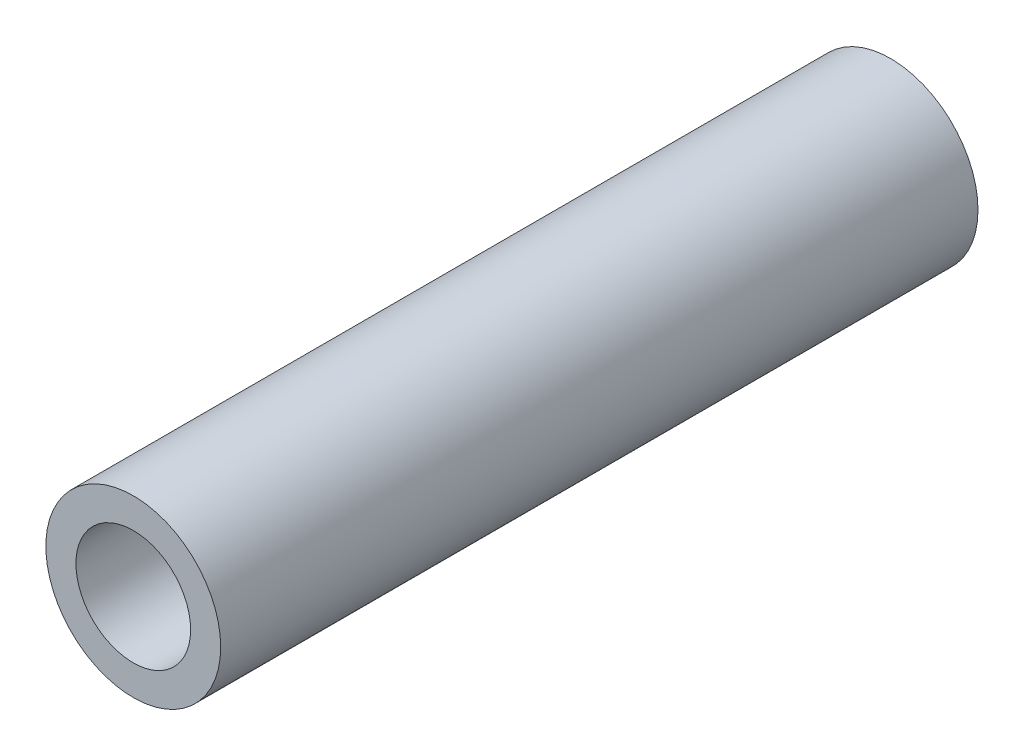
from build123d import *

# Parameters (mm, degrees)
SKETCH1_R           = 6.35
SKETCH1_R_2         = 4.165
BOSS_EXTRUDE1_DEPTH = 55


with BuildPart() as part:
    # Sketch1 → Boss-Extrude1 (new body)
    with BuildSketch(Plane.XY):
        Circle(SKETCH1_R)
        Circle(SKETCH1_R_2, mode=Mode.SUBTRACT)
    extrude(amount=BOSS_EXTRUDE1_DEPTH)


solid = part.part
